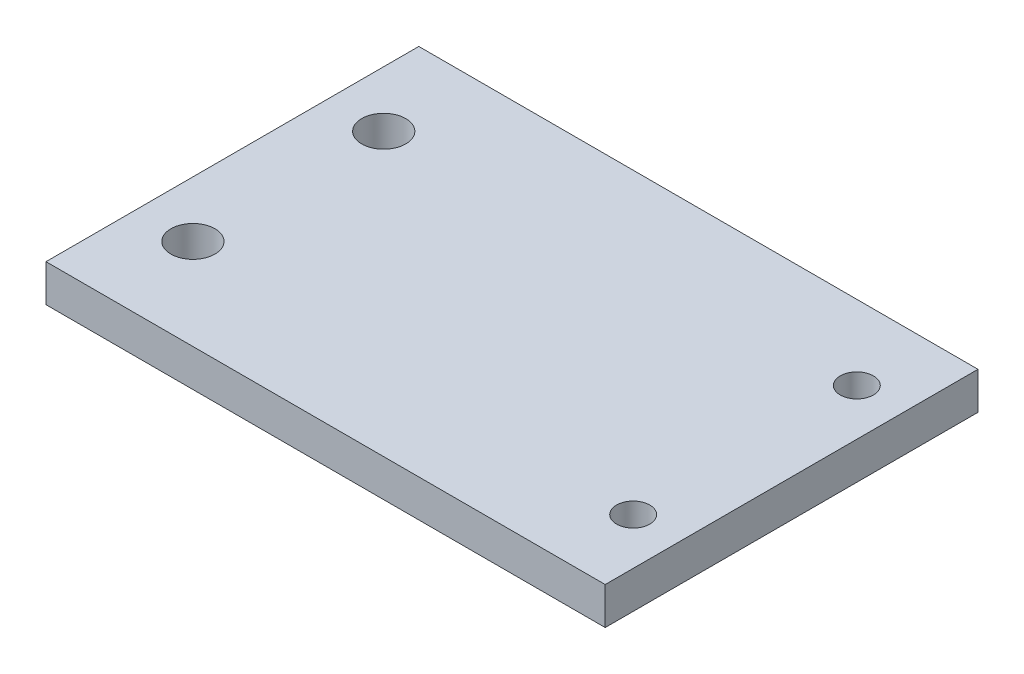
from build123d import *

# Parameters (mm, degrees)
SKETCH1_W               = 38.1
SKETCH1_H               = 25.4
BOSS_EXTRUDE1_DEPTH     = 2.54
CUT_EXTRUDE3_DEPTH      = 46.860894017
CUT_EXTRUDE3_DEPTH_BACK = 46.860894017
SKETCH2_R               = 1.5
SKETCH5_R               = 1.1303
CUT_EXTRUDE4_DEPTH      = 46.860894017


with BuildPart() as part:
    # Sketch1 → Boss-Extrude1 (new body)
    with BuildSketch(Plane(origin=(0, 0, 0), x_dir=(1, 0, 0), z_dir=(0, 1, 0))):
        with Locations((19.05, 12.7)):
            Rectangle(SKETCH1_W, SKETCH1_H)
    extrude(amount=BOSS_EXTRUDE1_DEPTH)

    # Sketch2 → Cut-Extrude3 (cut, two sides: drawn at the far end of the back side and taken through both)
    with BuildSketch(Plane(origin=(0, 2.54, 0), x_dir=(1, 0, 0), z_dir=(0, 1, 0)).offset(-CUT_EXTRUDE3_DEPTH_BACK)):
        with Locations((3.81, 19.2)):
            Circle(SKETCH2_R)
        with Locations((3.81, 6.2)):
            Circle(SKETCH2_R)
    extrude(amount=CUT_EXTRUDE3_DEPTH + CUT_EXTRUDE3_DEPTH_BACK, mode=Mode.SUBTRACT)

    # Sketch5 → Cut-Extrude4 (cut, through all)
    with BuildSketch(Plane(origin=(0, 2.54, 0), x_dir=(1, 0, 0), z_dir=(0, 1, 0))):
        with Locations((34.925, 20.32)):
            Circle(SKETCH5_R)
        with Locations((34.925, 5.08)):
            Circle(SKETCH5_R)
    extrude(amount=-CUT_EXTRUDE4_DEPTH, mode=Mode.SUBTRACT)


solid = part.part
